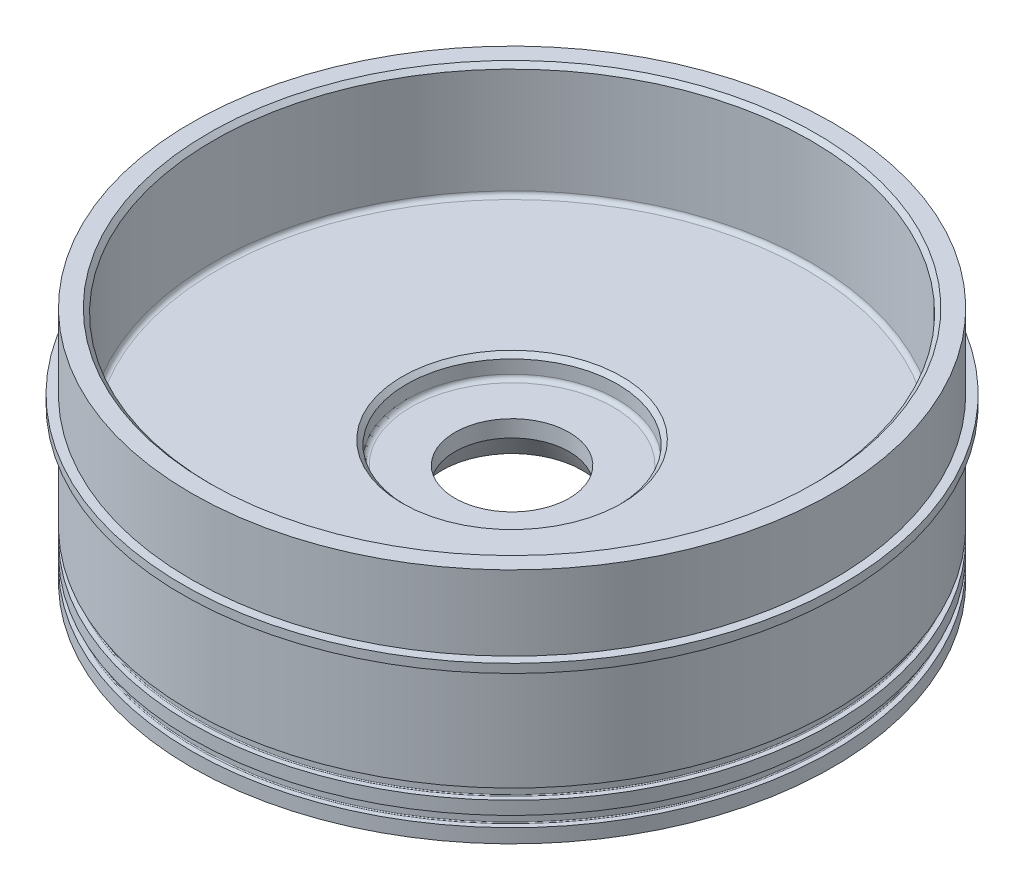
from build123d import *

# Parameters (mm, degrees)
SMUSSO1_SIZE  = 3
SMUSSO1_SIZE2 = 5.196152423
SMUSSO2_SIZE  = 1
RACCORDO1_R   = 1
SMUSSO3_SIZE  = 1
RACCORDO2_R   = 0.2
SCHIZZO2_W    = 11
SCHIZZO2_H    = 5
RACCORDO3_R   = 1
SMUSSO4_SIZE  = 1


with BuildPart() as part:
    # Schizzo1 → Rivoluzione1 (revolve)
    with BuildSketch(Plane.XY):
        Polygon((-69, 0), (-13, 0), (-13, 14), (-68, 14), (-68, 40), (-73, 40), (-73, 23), (-75, 23), (-75, 21), (-73, 21), (-73, -3), (-71.7, -3), (-71.7, -5.4), (-73, -5.4), (-73, -8.4), (-71.7, -8.4), (-71.7, -10.8), (-73, -10.8), (-73, -14), (-69, -14), align=None)
    revolve(axis=Axis((0, 0, 0), (0, 1, 0)))

    # Smusso1
    smusso1_edges = [part.edges().sort_by_distance(p)[0] for p in [
        (13, 0, 0),
    ]]
    smusso1_side = [part.faces().sort_by_distance(p)[0] for p in [
        (67.048385284, 0, 0),
    ]]
    chamfer(smusso1_edges, length=SMUSSO1_SIZE, length2=SMUSSO1_SIZE2, reference=smusso1_side[0])

    # Smusso2
    smusso2_edges = [part.edges().sort_by_distance(p)[0] for p in [
        (69, -14, 0),
    ]]
    chamfer(smusso2_edges, length=SMUSSO2_SIZE)

    # Raccordo1
    raccordo1_edges = [part.edges().sort_by_distance(p)[0] for p in [
        (69, 0, 0),
        (68, 14, 0),
    ]]
    fillet(raccordo1_edges, radius=RACCORDO1_R)

    # Smusso3
    smusso3_edges = [part.edges().sort_by_distance(p)[0] for p in [
        (68, 40, 0),
    ]]
    chamfer(smusso3_edges, length=SMUSSO3_SIZE)

    # Raccordo2
    raccordo2_edges = [part.edges().sort_by_distance(p)[0] for p in [
        (71.7, -8.4, 0),
        (71.7, -10.8, 0),
        (71.7, -3, 0),
        (71.7, -5.4, 0),
    ]]
    fillet(raccordo2_edges, radius=RACCORDO2_R)

    # Schizzo2 → Taglia-Rivoluzione1 (revolve, cut)
    with BuildSketch(Plane.XY):
        with Locations((-18.5, 11.5)):
            Rectangle(SCHIZZO2_W, SCHIZZO2_H)
    revolve(axis=Axis((0, 0, 0), (0, 1, 0)), mode=Mode.SUBTRACT)

    # Raccordo3
    raccordo3_edges = [part.edges().sort_by_distance(p)[0] for p in [
        (24, 9, 0),
    ]]
    fillet(raccordo3_edges, radius=RACCORDO3_R)

    # Smusso4
    smusso4_edges = [part.edges().sort_by_distance(p)[0] for p in [
        (24, 14, 0),
    ]]
    chamfer(smusso4_edges, length=SMUSSO4_SIZE)


solid = part.part
